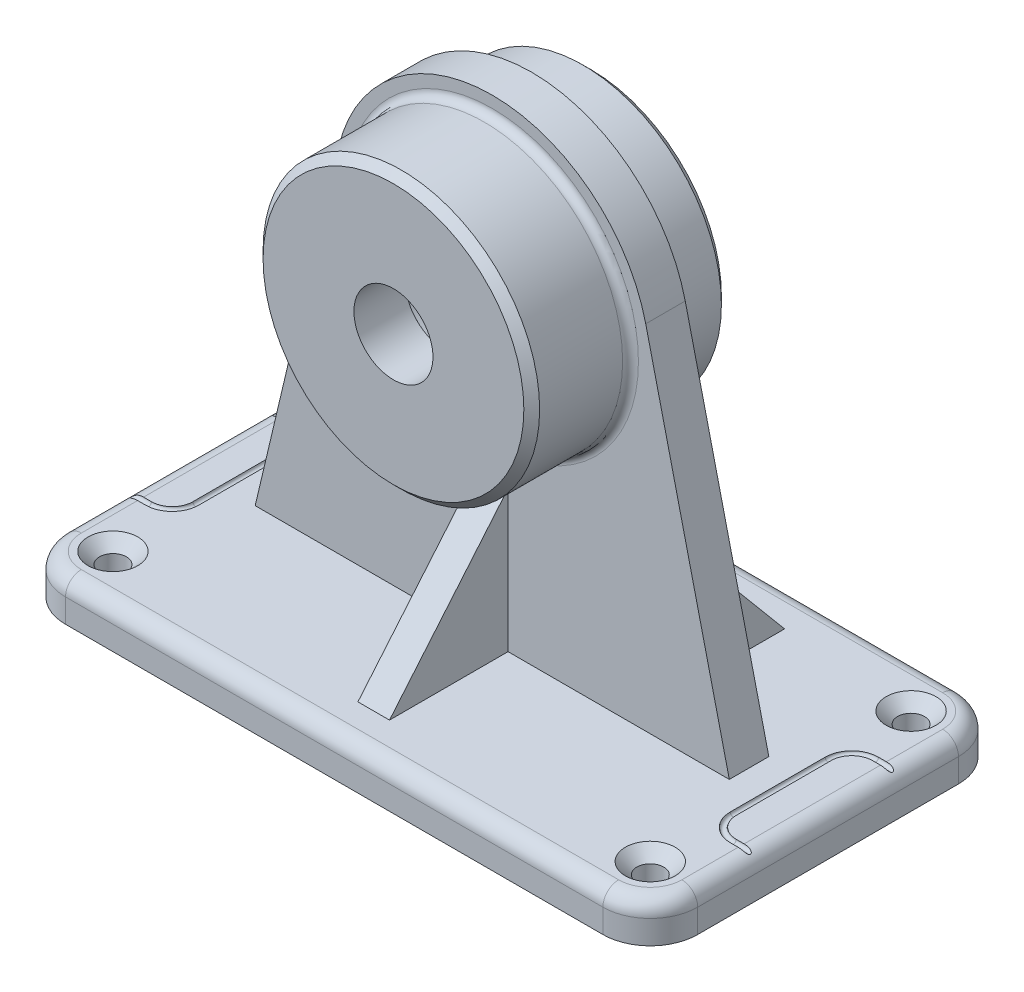
from build123d import *

# Parameters (mm, degrees)
SKETCH1_W                                           = 80
SKETCH1_H                                           = 45
BOSS_EXTRUDE1_DEPTH                                 = 5
CUT_EXTRUDE1_DEPTH                                  = 5
FILLET1_R                                           = 6
FILLET2_R                                           = 6
FILLET3_R                                           = 6
FILLET4_R                                           = 6
CUT_SWEEP1_PROFILE_R                                = 0.375
FILLET5_R                                           = 2
CSK_FOR_M3_COUNTERSUNK_FLAT_HEAD_SCREW1_D           = 3.4
CSK_FOR_M3_COUNTERSUNK_FLAT_HEAD_SCREW1_CSINK_D     = 6.3
CSK_FOR_M3_COUNTERSUNK_FLAT_HEAD_SCREW1_CSINK_ANGLE = 90
CHAMFER2_SIZE                                       = 2
BOSS_EXTRUDE2_DEPTH                                 = 2.5
SKETCH20_R                                          = 17.5
BOSS_EXTRUDE3_DEPTH                                 = 12.5
CHAMFER3_SIZE                                       = 1
FILLET6_R                                           = 1
RIB1_REACH                                          = 81.569
SKETCH21_WALL_W                                     = 184.474162132
SKETCH21_WALL_H                                     = 4
RIB2_REACH                                          = 90.07
SKETCH22_WALL_W                                     = 201.475007066
SKETCH22_WALL_H                                     = 4


with BuildPart() as part:
    # Sketch1 → Boss-Extrude1 (new body)
    with BuildSketch(Plane(origin=(0, 0, 0), x_dir=(1, 0, 0), z_dir=(0, 1, 0))):
        Rectangle(SKETCH1_W, SKETCH1_H)
    extrude(amount=BOSS_EXTRUDE1_DEPTH)

    # Sketch2 → Cut-Extrude1 (cut)
    with BuildSketch(Plane(origin=(0, 5, 0), x_dir=(1, 0, 0), z_dir=(0, 1, 0))):
        with BuildLine():
            Line((7, 7.5), (-7, 7.5))
            ThreePointArc((-7, 7.5), (-10, 10.5), (-7, 13.5))
            Line((-7, 13.5), (7, 13.5))
            ThreePointArc((7, 13.5), (10, 10.5), (7, 7.5))
        make_face()
    extrude(amount=-CUT_EXTRUDE1_DEPTH, mode=Mode.SUBTRACT)

    # Fillet1
    fillet1_edges = [part.edges().sort_by_distance(p)[0] for p in [
        (-40, 2.5, -22.5),
    ]]
    fillet(fillet1_edges, radius=FILLET1_R)

    # Fillet2
    fillet2_edges = [part.edges().sort_by_distance(p)[0] for p in [
        (-40, 2.5, 22.5),
    ]]
    fillet(fillet2_edges, radius=FILLET2_R)

    # Fillet3
    fillet3_edges = [part.edges().sort_by_distance(p)[0] for p in [
        (40, 2.5, 22.5),
    ]]
    fillet(fillet3_edges, radius=FILLET3_R)

    # Fillet4
    fillet4_edges = [part.edges().sort_by_distance(p)[0] for p in [
        (40, 2.5, -22.5),
    ]]
    fillet(fillet4_edges, radius=FILLET4_R)

    # Cut-Sweep1: sweep along a path in Sketch3
    with BuildLine(Plane(origin=(0, 5, 0), x_dir=(1, 0, 0), z_dir=(0, 1, 0))) as cut_sweep1_path:
        Line((40, -9), (37, -9))
        ThreePointArc((37, -9), (34.878679656, -8.121320344), (34, -6))
        Line((34, -6), (34, 6))
        ThreePointArc((34, 6), (34.878679656, 8.121320344), (37, 9))
        Line((37, 9), (40, 9))
    # Cut-Sweep1 profile (on start of the path) → Cut-Sweep1 (sweep, cut)
    with BuildSketch(Plane(origin=(40, 5, 9), x_dir=(0, 0, -1), z_dir=(-1, 0, 0))):
        Circle(CUT_SWEEP1_PROFILE_R)
    cut_sweep1 = sweep(path=cut_sweep1_path.line, mode=Mode.SUBTRACT)

    # Mirror1: Cut-Sweep1 across plane
    add(cut_sweep1.mirror(Plane(origin=(0, 0, 0), x_dir=(0, 0, 1), z_dir=(1, 0, 0))), mode=Mode.SUBTRACT)

    # Fillet5
    # the kernel refuses this fillet: 2 mm, written as the material it takes off along each edge
    with BuildSketch(Plane(origin=(-40, 5, -4.375), x_dir=(0, -1, 0), z_dir=(0, 0, -1)), Plane(origin=(40, 5, 4.375), x_dir=(0, -1, 0), z_dir=(0, 0, 1)), Plane(origin=(40, 5, -16.5), x_dir=(0, -1, 0), z_dir=(0, 0, 1)), Plane(origin=(-40, 5, 16.5), x_dir=(0, -1, 0), z_dir=(0, 0, -1))) as fillet5_piece_1:
        with BuildLine():
            CenterArc((FILLET5_R, -FILLET5_R), FILLET5_R, 90, 90)
            Line((0, -FILLET5_R), (0, 0))
            Line((0, 0), (FILLET5_R, 0))
        make_face()
    extrude(amount=12.125, mode=Mode.SUBTRACT)
    with BuildSketch(Plane(origin=(-34, 5, -16.5), x_dir=(-1, 0, 0), z_dir=(0, 0, 1))) as fillet5_piece_2:
        with BuildLine():
            CenterArc((6 - FILLET5_R, FILLET5_R), FILLET5_R, 270, 90)
            Line((6 - FILLET5_R, 0), (6, 0))
            Line((6, 0), (6, FILLET5_R))
        make_face()
    revolve(axis=Axis((-34, 5, -16.5), (0, -1, 0)), revolution_arc=90, mode=Mode.SUBTRACT)
    with BuildSketch(Plane(origin=(34, 5, 22.5), x_dir=(0, -1, 0), z_dir=(-1, 0, 0)), Plane(origin=(-34, 5, -22.5), x_dir=(0, -1, 0), z_dir=(1, 0, 0))) as fillet5_piece_3:
        with BuildLine():
            CenterArc((FILLET5_R, -FILLET5_R), FILLET5_R, 90, 90)
            Line((0, -FILLET5_R), (0, 0))
            Line((0, 0), (FILLET5_R, 0))
        make_face()
    extrude(amount=68, mode=Mode.SUBTRACT)
    with BuildSketch(Plane(origin=(-34, 5, 16.5), x_dir=(-1, 0, 0), z_dir=(0, 0, -1))) as fillet5_piece_4:
        with BuildLine():
            CenterArc((6 - FILLET5_R, -FILLET5_R), FILLET5_R, 0, 90)
            Line((6 - FILLET5_R, 0), (6, 0))
            Line((6, 0), (6, -FILLET5_R))
        make_face()
    revolve(axis=Axis((-34, 5, 16.5), (0, 1, 0)), revolution_arc=90, mode=Mode.SUBTRACT)
    with BuildSketch(Plane(origin=(34, 5, 16.5), x_dir=(0, 0, 1), z_dir=(-1, 0, 0))) as fillet5_piece_5:
        with BuildLine():
            CenterArc((6 - FILLET5_R, -FILLET5_R), FILLET5_R, 0, 90)
            Line((6 - FILLET5_R, 0), (6, 0))
            Line((6, 0), (6, -FILLET5_R))
        make_face()
    revolve(axis=Axis((34, 5, 16.5), (0, 1, 0)), revolution_arc=90, mode=Mode.SUBTRACT)
    with BuildSketch(Plane(origin=(34, 5, -16.5), x_dir=(1, 0, 0), z_dir=(0, 0, 1))) as fillet5_piece_6:
        with BuildLine():
            CenterArc((6 - FILLET5_R, -FILLET5_R), FILLET5_R, 0, 90)
            Line((6 - FILLET5_R, 0), (6, 0))
            Line((6, 0), (6, -FILLET5_R))
        make_face()
    revolve(axis=Axis((34, 5, -16.5), (0, 1, 0)), revolution_arc=90, mode=Mode.SUBTRACT)
    with BuildSketch(Plane(origin=(40, 5, -13.625), x_dir=(0, -1, 0), z_dir=(0, 0, 1)), Plane(origin=(-40, 5, 13.625), x_dir=(0, -1, 0), z_dir=(0, 0, -1))) as fillet5_piece_7:
        with BuildLine():
            CenterArc((FILLET5_R, -FILLET5_R), FILLET5_R, 90, 90)
            Line((0, -FILLET5_R), (0, 0))
            Line((0, 0), (FILLET5_R, 0))
        make_face()
    extrude(amount=27.25, mode=Mode.SUBTRACT)

    # CSK for M3 Countersunk Flat Head Screw1 (through all)
    with Locations(Plane(origin=(0, 5, 0), x_dir=(1, 0, 0), z_dir=(0, 1, 0))):
        with Locations((34, 16.5), (34, -16.5), (-34, -16.5), (-34, 16.5)):
            CounterSinkHole(CSK_FOR_M3_COUNTERSUNK_FLAT_HEAD_SCREW1_D / 2, CSK_FOR_M3_COUNTERSUNK_FLAT_HEAD_SCREW1_CSINK_D / 2, counter_sink_angle=CSK_FOR_M3_COUNTERSUNK_FLAT_HEAD_SCREW1_CSINK_ANGLE)

    # Chamfer2
    chamfer2_edges = [part.edges().sort_by_distance(p)[0] for p in [
        (10, 5, -10.5),
        (0, 5, -13.5),
        (-10, 5, -10.5),
        (0, 5, -7.5),
    ]]
    chamfer(chamfer2_edges, length=CHAMFER2_SIZE)

    # Sketch19 → Boss-Extrude2 (add, symmetric)
    with BuildSketch(Plane.XY):
        with BuildLine():
            Line((0, 5), (-30, 5))
            Line((-30, 5), (-19.422440363, 49.641807085))
            ThreePointArc((-19.422440363, 49.641807085), (0, 65), (19.422440363, 49.641807085))
            Line((19.422440363, 49.641807085), (30, 5))
            Line((30, 5), (0, 5))
        make_face()
    extrude(amount=BOSS_EXTRUDE2_DEPTH, both=True)

    # Sketch20 → Boss-Extrude3 (add, symmetric)
    with BuildSketch(Plane.XY.offset(2.5)):
        with Locations(Location((0, 45.039797564, 0), (0, 0, 180))):
            Circle(SKETCH20_R)
    extrude(amount=BOSS_EXTRUDE3_DEPTH, both=True)

    # Chamfer3
    chamfer3_edges = [part.edges().sort_by_distance(p)[0] for p in [
        (17.5, 45.039797564, -10),
        (17.5, 45.039797564, 15),
    ]]
    chamfer(chamfer3_edges, length=CHAMFER3_SIZE)

    # Fillet6
    fillet6_edges = [part.edges().sort_by_distance(p)[0] for p in [
        (17.5, 45.039797564, 2.5),
        (17.5, 45.039797564, -2.5),
    ]]
    fillet(fillet6_edges, radius=FILLET6_R)

    # Sketch21 wall → Rib1 (add, up to next)
    with BuildSketch(Plane(origin=(0, 13.938151944, 10), x_dir=(0, 0.766044443121, -0.642787609685), z_dir=(0, 0.642787609685, 0.766044443121)), mode=Mode.PRIVATE) as rib1_sk1:
        Rectangle(SKETCH21_WALL_W, SKETCH21_WALL_H)
    rib1_tool1 = extrude(rib1_sk1.sketch, amount=-RIB1_REACH, mode=Mode.PRIVATE) - part.part
    add(rib1_tool1.solids().sort_by_distance((0, 13.938151944, 10))[0])

    # Sketch22 wall → Rib2 (add, up to next)
    with BuildSketch(Plane(origin=(15, 13.938151944, -10), x_dir=(0, 0.766044443121, 0.642787609685), z_dir=(0, -0.642787609685, 0.766044443121)), mode=Mode.PRIVATE) as rib2_sk1:
        Rectangle(SKETCH22_WALL_W, SKETCH22_WALL_H)
    rib2_tool1 = extrude(rib2_sk1.sketch, amount=RIB2_REACH, mode=Mode.PRIVATE) - part.part
    rib2 = rib2_tool1.solids().sort_by_distance((15, 13.938151944, -10))[0]
    add(rib2)

    # Mirror2: Rib2 across plane
    add(rib2.mirror(Plane(origin=(0, 0, 0), x_dir=(0, 0, 1), z_dir=(1, 0, 0))))

    # Sketch23 → Cut-Revolve1 (revolve, cut)
    with BuildSketch(Plane(origin=(0, 0, 0), x_dir=(0, 0, -1), z_dir=(1, 0, 0)), mode=Mode.PRIVATE) as cut_revolve1_sk:
        Polygon((10, 45.039797564), (10, 55.039797564), (4.000622615, 55.039797564), (4.000622615, 53.039797564), (-6.399377385, 53.039797564), (-8.5, 50.039797564), (-15, 50.039797564), (-15, 45.039797564), align=None)
    revolve(cut_revolve1_sk.sketch.rotate(Axis((0, 45.039797564, -10), (0, 0, 1)), 90), axis=Axis((0, 45.039797564, -10), (0, 0, 1)), mode=Mode.SUBTRACT)


solid = part.part
